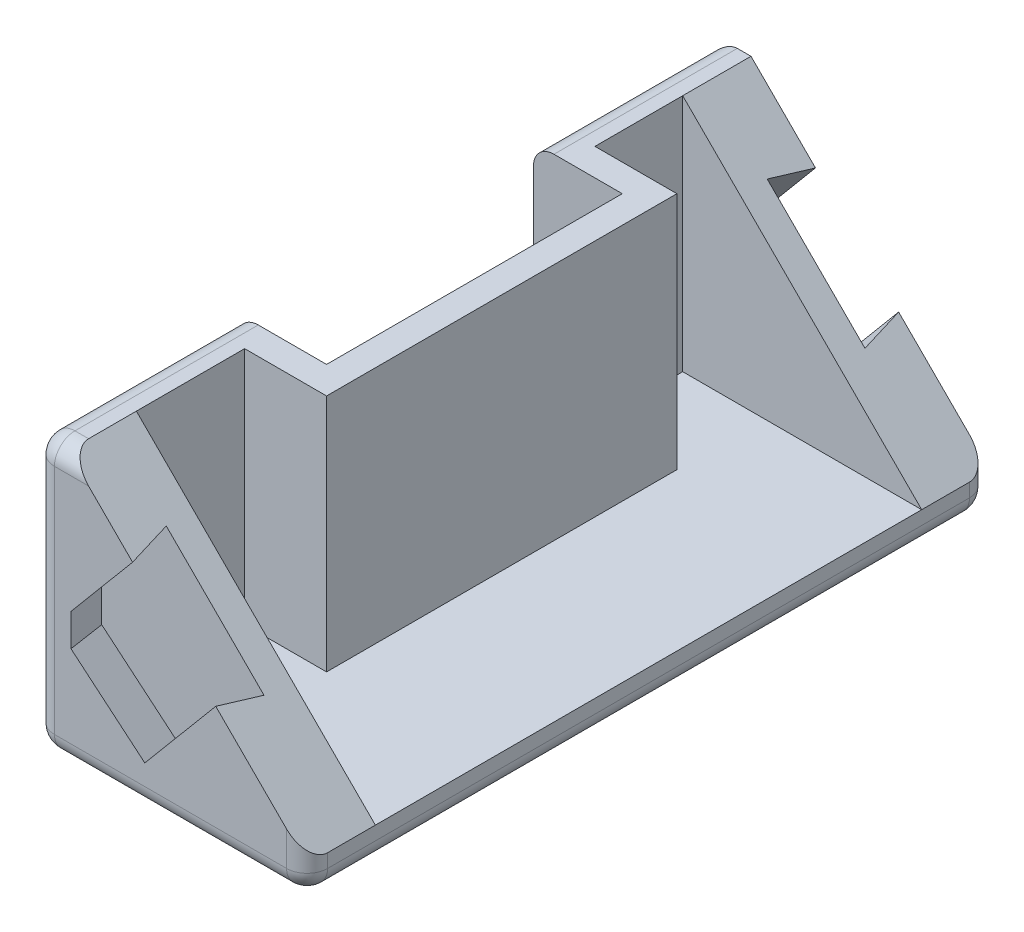
from build123d import *

# Parameters (mm, degrees)
EXTRUDE_1_DEPTH     = 10
EXTRUDE_3_DEPTH     = 40
FILLET_2_R          = 3
FILLET_3_R          = 3
SKETCH_10_W         = 43.3
SKETCH_10_H         = 35
CUT_EXTRUDE_1_DEPTH = 12.8
EXTRUDE_4_DEPTH     = 35


with BuildPart() as part:
    # 草图3 → 凸台-拉伸1 (new body)
    with BuildSketch(Plane.XY):
        Polygon((-100, -79.175359259), (-100, -119.175359259), (-60, -119.175359259), (-60, -114.175359259), (-95, -79.175359259), align=None)
    extrude(amount=-EXTRUDE_1_DEPTH)

    # 草图5 → 切除-放样1 section 0
    with BuildSketch(Plane.XY.offset(-6)):
        with BuildLine():
            Line((-96.08, -104.799041882), (-96.08, -98.821989002))
            Line((-96.08, -98.821989002), (-81.709132385, -81.695455893))
            Line((-81.709132385, -81.695455893), (-66.265676412, -94.654054104))
            Line((-66.265676412, -94.654054104), (-83.579668035, -115.288065824))
            Line((-83.579668035, -115.288065824), (-96.08, -104.799041882))
        make_face()
    # 草图8 → 切除-放样1 section 1
    with BuildSketch(Plane.XY):
        with BuildLine():
            Line((-94.58, -104.099580395), (-94.58, -99.367944353))
            Line((-94.58, -99.367944353), (-80.56006572, -82.659637307))
            Line((-80.56006572, -82.659637307), (-67.414743077, -93.68987269))
            Line((-67.414743077, -93.68987269), (-83.764553285, -113.174817744))
            Line((-83.764553285, -113.174817744), (-94.58, -104.099580395))
        make_face()
    loft(mode=Mode.SUBTRACT)

    # 草图9 → 凸台-拉伸3 (add)
    with BuildSketch(Plane(origin=(0, 0, -10), x_dir=(-1, 0, 0), z_dir=(0, 0, -1))):
        Polygon((95, -79.175359259), (95, -114.175359259), (60, -114.175359259), (60, -119.175359259), (100, -119.175359259), (100, -79.175359259), align=None)
    extrude(amount=EXTRUDE_3_DEPTH)

    # 镜向2: part across plane


with BuildPart() as part_1:
    add(part.part)
    add(part.part.mirror(Plane(origin=(0, 0, -50), x_dir=(1, 0, 0), z_dir=(0, 0, -1))))

    # 圆角2
    fillet_2_edges = [part_1.edges().sort_by_distance(p)[0] for p in [
        (-60, -116.675359259, -100),
        (-60, -116.675359259, 0),
        (-100, -99.175359259, -100),
        (-100, -99.175359259, 0),
        (-100, -79.175359259, -50),
        (-97.5, -79.175359259, 0),
    ]]
    fillet(fillet_2_edges, radius=FILLET_2_R)

    # 圆角3
    fillet_3_edges = [part_1.edges().sort_by_distance(p)[0] for p in [
        (-80, -119.175359259, -100),
        (-80, -119.175359259, 0),
        (-100, -119.175359259, -50),
        (-60, -119.175359259, -50),
        (-99.121320344, -119.175359259, -0.878679656),
        (-99.121320344, -119.175359259, -99.121320344),
        (-60.878679656, -119.175359259, -0.878679656),
        (-60.878679656, -119.175359259, -99.121320344),
    ]]
    fillet(fillet_3_edges, radius=FILLET_3_R)

    # 草图10 → 切除-拉伸1 (cut)
    with BuildSketch(Plane.ZY.offset(100)):
        with Locations((-51.5, -96.675359259)):
            Rectangle(SKETCH_10_W, SKETCH_10_H)
    extrude(amount=-CUT_EXTRUDE_1_DEPTH, mode=Mode.SUBTRACT)

    # 草图11 → 凸台-拉伸4 (add)
    with BuildSketch(Plane(origin=(0, -114.175359259, 0), x_dir=(1, 0, 0), z_dir=(0, 1, 0))):
        Polygon((-95, 25.85), (-83, 25.85), (-83, 77.15), (-95, 77.15), (-95, 73.15), (-87, 73.15), (-87, 29.85), (-95, 29.85), align=None)
    extrude(amount=EXTRUDE_4_DEPTH)


solid = part_1.part
